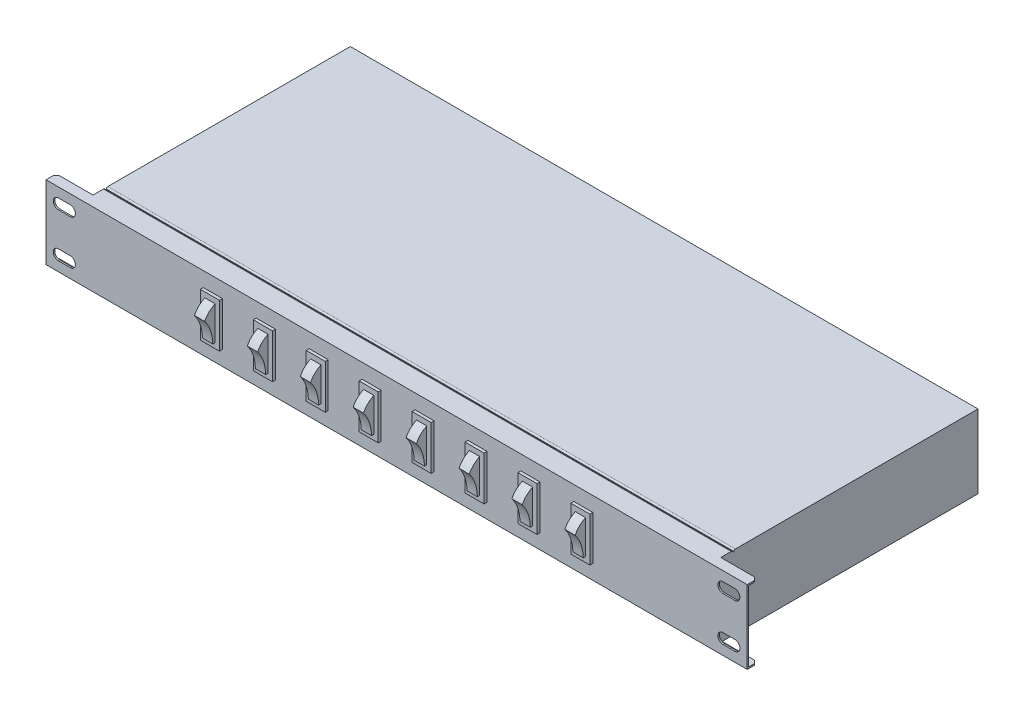
from build123d import *

# Parameters (mm, degrees)
SKETCH1_W           = 427
SKETCH1_H           = 182
BOSS_EXTRUDE1_DEPTH = 50
SKETCH2_W           = 25
SKETCH2_H           = 50
BOSS_EXTRUDE2_DEPTH = 1
SKETCH3_W           = 25
SKETCH3_H           = 1
BOSS_EXTRUDE3_DEPTH = 6
CHAMFER1_SIZE       = 2
SKETCH4_W           = 13
SKETCH4_H           = 30
BOSS_EXTRUDE4_DEPTH = 2
SKETCH5_W           = 7
SKETCH5_H           = 23
BOSS_EXTRUDE5_DEPTH = 7
CUT_EXTRUDE1_DEPTH  = 267
SKETCH7_W           = 427
SKETCH7_H           = 1
CUT_EXTRUDE2_DEPTH  = 1
SKETCH8_W           = 427
SKETCH8_H           = 1
CUT_EXTRUDE3_DEPTH  = 1
FILLET1_R           = 1
SKETCH9_W           = 29
SKETCH9_H           = 26
BOSS_EXTRUDE6_DEPTH = 4
SKETCH10_R          = 2.375
SKETCH10_W          = 1.5
SKETCH10_H          = 6.35
CUT_EXTRUDE4_DEPTH  = 15
CHAMFER2_SIZE       = 1
BOSS_EXTRUDE7_DEPTH = 3.5
BOSS_EXTRUDE8_DEPTH = 1.5
SKETCH13_W          = 24
SKETCH13_H          = 12
SKETCH13_W_2        = 16
SKETCH13_H_2        = 4
CUT_EXTRUDE5_DEPTH  = 15
SKETCH14_W          = 1.5
SKETCH14_H          = 3
BOSS_EXTRUDE9_DEPTH = 14
CHAMFER3_SIZE       = 0.75
SKETCH15_W          = 24
SKETCH15_H          = 8
SKETCH15_W_2        = 23
SKETCH15_H_2        = 7
CUT_EXTRUDE6_DEPTH  = 0.5


with BuildPart() as part:
    # Sketch1 → Boss-Extrude1 (new body)
    with BuildSketch(Plane(origin=(0, 0, 0), x_dir=(1, 0, 0), z_dir=(0, 1, 0))):
        with Locations((213.5, 91)):
            Rectangle(SKETCH1_W, SKETCH1_H)
    extrude(amount=BOSS_EXTRUDE1_DEPTH)

    # Sketch2 → Boss-Extrude2 (add)
    # profile 1 of 2: a face of its own
    with BuildSketch(Plane.XY):
        with Locations((-12.5, 25)):
            Rectangle(SKETCH2_W, SKETCH2_H)
        with BuildLine():
            ThreePointArc((-16.538466331, 6.5), (-20.038466331, 10), (-16.538466331, 13.5))
            Line((-16.538466331, 13.5), (-8.538466331, 13.5))
            ThreePointArc((-8.538466331, 13.5), (-6.063592596, 12.474873734), (-5.038466331, 10))
            ThreePointArc((-5.038466331, 10), (-6.063592596, 7.525126266), (-8.538466331, 6.5))
            Line((-8.538466331, 6.5), (-16.538466331, 6.5))
        make_face(mode=Mode.SUBTRACT)
        with BuildLine():
            ThreePointArc((-16.538466331, 36.5), (-20.038466331, 40), (-16.538466331, 43.5))
            Line((-16.538466331, 43.5), (-8.538466331, 43.5))
            ThreePointArc((-8.538466331, 43.5), (-6.063592596, 42.474873734), (-5.038466331, 40))
            ThreePointArc((-5.038466331, 40), (-6.063592596, 37.525126266), (-8.538466331, 36.5))
            Line((-8.538466331, 36.5), (-16.538466331, 36.5))
        make_face(mode=Mode.SUBTRACT)
    # profile 2 of 2: a face of its own
    with BuildSketch(Plane.XY):
        with Locations((439.5, 25)):
            Rectangle(SKETCH2_W, SKETCH2_H)
        with BuildLine():
            ThreePointArc((447.038466331, 10), (446.013340065, 7.525126266), (443.538466331, 6.5))
            Line((443.538466331, 6.5), (435.538466331, 6.5))
            ThreePointArc((435.538466331, 6.5), (432.038466331, 10), (435.538466331, 13.5))
            Line((435.538466331, 13.5), (443.538466331, 13.5))
            ThreePointArc((443.538466331, 13.5), (446.013340065, 12.474873734), (447.038466331, 10))
        make_face(mode=Mode.SUBTRACT)
        with BuildLine():
            ThreePointArc((447.038466331, 40), (446.013340065, 37.525126266), (443.538466331, 36.5))
            Line((443.538466331, 36.5), (435.538466331, 36.5))
            ThreePointArc((435.538466331, 36.5), (432.038466331, 40), (435.538466331, 43.5))
            Line((435.538466331, 43.5), (443.538466331, 43.5))
            ThreePointArc((443.538466331, 43.5), (446.013340065, 42.474873734), (447.038466331, 40))
        make_face(mode=Mode.SUBTRACT)
    extrude(amount=-BOSS_EXTRUDE2_DEPTH)

    # Sketch3 → Boss-Extrude3 (add)
    with BuildSketch(Plane(origin=(0, 0, -1), x_dir=(-1, 0, 0), z_dir=(0, 0, -1))):
        with Locations((12.5, 0.5)):
            Rectangle(SKETCH3_W, SKETCH3_H)
        with Locations((12.5, 49.5)):
            Rectangle(SKETCH3_W, SKETCH3_H)
        with Locations((-439.5, 49.5)):
            Rectangle(SKETCH3_W, SKETCH3_H)
        with Locations((-439.5, 0.5)):
            Rectangle(SKETCH3_W, SKETCH3_H)
    extrude(amount=BOSS_EXTRUDE3_DEPTH)

    # Chamfer1
    chamfer1_edges = [part.edges().sort_by_distance(p)[0] for p in [
        (452, 49.5, -7),
        (452, 0.5, -7),
        (-25, 0.5, -7),
        (-25, 49.5, -7),
    ]]
    chamfer(chamfer1_edges, length=CHAMFER1_SIZE)

    # Sketch4 → Boss-Extrude4 (add)
    with BuildSketch(Plane.XY):
        with Locations((88.5, 25)):
            Rectangle(SKETCH4_W, SKETCH4_H)
        with Locations((124.5, 25)):
            Rectangle(SKETCH4_W, SKETCH4_H)
        with Locations((160.5, 25)):
            Rectangle(SKETCH4_W, SKETCH4_H)
        with Locations((196.5, 25)):
            Rectangle(SKETCH4_W, SKETCH4_H)
        with Locations((232.5, 25)):
            Rectangle(SKETCH4_W, SKETCH4_H)
        with Locations((268.5, 25)):
            Rectangle(SKETCH4_W, SKETCH4_H)
        with Locations((304.5, 25)):
            Rectangle(SKETCH4_W, SKETCH4_H)
        with Locations((340.5, 25)):
            Rectangle(SKETCH4_W, SKETCH4_H)
    extrude(amount=BOSS_EXTRUDE4_DEPTH)

    # Sketch5 → Boss-Extrude5 (add)
    with BuildSketch(Plane.XY.offset(2)):
        with Locations((88.5, 25)):
            Rectangle(SKETCH5_W, SKETCH5_H)
        with Locations((124.5, 25)):
            Rectangle(SKETCH5_W, SKETCH5_H)
        with Locations((160.5, 25)):
            Rectangle(SKETCH5_W, SKETCH5_H)
        with Locations((196.5, 25)):
            Rectangle(SKETCH5_W, SKETCH5_H)
        with Locations((232.5, 25)):
            Rectangle(SKETCH5_W, SKETCH5_H)
        with Locations((268.5, 25)):
            Rectangle(SKETCH5_W, SKETCH5_H)
        with Locations((304.5, 25)):
            Rectangle(SKETCH5_W, SKETCH5_H)
        with Locations((340.5, 25)):
            Rectangle(SKETCH5_W, SKETCH5_H)
    extrude(amount=BOSS_EXTRUDE5_DEPTH)

    # Sketch6 → Cut-Extrude1 (cut)
    with BuildSketch(Plane.ZY.offset(-85)):
        with BuildLine():
            add(Edge.make_bspline(
                [(3.5, 13.5), (3.899235476, 22.933492856), (9, 29.5)],
                knots=[0, 0, 0, 0.757593428, 0.757593428, 0.757593428], degree=2))
            Line((3.5, 13.5), (9, 13.5))
            Line((9, 13.5), (9, 29.5))
        make_face()
        with BuildLine():
            Line((9, 36.5), (2, 36.5))
            add(Edge.make_bspline(
                [(2, 36.5), (7.238831178, 33.720247457), (9, 29.5)],
                knots=[0, 0, 0, 0.496808908, 0.496808908, 0.496808908], degree=2))
            Line((9, 29.5), (9, 36.5))
        make_face()
    extrude(amount=-CUT_EXTRUDE1_DEPTH, mode=Mode.SUBTRACT)

    # Sketch7 → Cut-Extrude2 (cut)
    with BuildSketch(Plane(origin=(0, 50, 0), x_dir=(1, 0, 0), z_dir=(0, 1, 0))):
        with Locations((213.5, 15.5)):
            Rectangle(SKETCH7_W, SKETCH7_H)
    extrude(amount=-CUT_EXTRUDE2_DEPTH, mode=Mode.SUBTRACT)

    # Sketch8 → Cut-Extrude3 (cut)
    with BuildSketch(Plane.XZ):
        with Locations((213.5, -15.5)):
            Rectangle(SKETCH8_W, SKETCH8_H)
    extrude(amount=-CUT_EXTRUDE3_DEPTH, mode=Mode.SUBTRACT)

    # Fillet1
    fillet1_edges = [part.edges().sort_by_distance(p)[0] for p in [
        (213.5, 50, -15),
        (213.5, 50, -16),
        (213.5, 0, -15),
        (213.5, 0, -16),
    ]]
    fillet(fillet1_edges, radius=FILLET1_R - 0.0001)  # a hair under: the kernel refuses the full size

    # Sketch9 → Boss-Extrude6 (add)
    with BuildSketch(Plane(origin=(0, 0, -182), x_dir=(-1, 0, 0), z_dir=(0, 0, -1))):
        with Locations((-368.5, 25)):
            Rectangle(SKETCH9_W, SKETCH9_H)
        with Locations((-328.5, 25)):
            Rectangle(SKETCH9_W, SKETCH9_H)
        with Locations((-288.5, 25)):
            Rectangle(SKETCH9_W, SKETCH9_H)
        with Locations((-248.5, 25)):
            Rectangle(SKETCH9_W, SKETCH9_H)
        with Locations((-208.5, 25)):
            Rectangle(SKETCH9_W, SKETCH9_H)
        with Locations((-168.5, 25)):
            Rectangle(SKETCH9_W, SKETCH9_H)
        with Locations((-128.5, 25)):
            Rectangle(SKETCH9_W, SKETCH9_H)
        with Locations((-88.5, 25)):
            Rectangle(SKETCH9_W, SKETCH9_H)
    extrude(amount=BOSS_EXTRUDE6_DEPTH)

    # Sketch10 → Cut-Extrude4 (cut)
    with BuildSketch(Plane(origin=(0, 0, -186), x_dir=(-1, 0, 0), z_dir=(0, 0, -1))):
        with Locations((-368.5, 18)):
            Circle(SKETCH10_R)
        with Locations((-328.5, 18)):
            Circle(SKETCH10_R)
        with Locations((-288.5, 18)):
            Circle(SKETCH10_R)
        with Locations((-248.5, 18)):
            Circle(SKETCH10_R)
        with Locations((-208.5, 18)):
            Circle(SKETCH10_R)
        with Locations((-168.5, 18)):
            Circle(SKETCH10_R)
        with Locations((-128.5, 18)):
            Circle(SKETCH10_R)
        with Locations((-88.5, 18)):
            Circle(SKETCH10_R)
        with Locations((-374.85, 29.9)):
            Rectangle(SKETCH10_W, SKETCH10_H)
        with Locations((-362.15, 29.9)):
            Rectangle(SKETCH10_W, SKETCH10_H)
        with Locations((-322.15, 29.9)):
            Rectangle(SKETCH10_W, SKETCH10_H)
        with Locations((-334.85, 29.9)):
            Rectangle(SKETCH10_W, SKETCH10_H)
        with Locations((-282.15, 29.9)):
            Rectangle(SKETCH10_W, SKETCH10_H)
        with Locations((-294.85, 29.9)):
            Rectangle(SKETCH10_W, SKETCH10_H)
        with Locations((-242.15, 29.9)):
            Rectangle(SKETCH10_W, SKETCH10_H)
        with Locations((-254.85, 29.9)):
            Rectangle(SKETCH10_W, SKETCH10_H)
        with Locations((-202.15, 29.9)):
            Rectangle(SKETCH10_W, SKETCH10_H)
        with Locations((-214.85, 29.9)):
            Rectangle(SKETCH10_W, SKETCH10_H)
        with Locations((-162.15, 29.9)):
            Rectangle(SKETCH10_W, SKETCH10_H)
        with Locations((-174.85, 29.9)):
            Rectangle(SKETCH10_W, SKETCH10_H)
        with Locations((-122.15, 29.9)):
            Rectangle(SKETCH10_W, SKETCH10_H)
        with Locations((-134.85, 29.9)):
            Rectangle(SKETCH10_W, SKETCH10_H)
        with Locations((-82.15, 29.9)):
            Rectangle(SKETCH10_W, SKETCH10_H)
        with Locations((-94.85, 29.9)):
            Rectangle(SKETCH10_W, SKETCH10_H)
    extrude(amount=-CUT_EXTRUDE4_DEPTH, mode=Mode.SUBTRACT)

    # Chamfer2
    chamfer2_edges = [part.edges().sort_by_distance(p)[0] for p in [
        (370.875, 18, -186),
        (375.6, 29.9, -186),
        (374.85, 26.725, -186),
        (374.1, 29.9, -186),
        (374.85, 33.075, -186),
        (362.9, 29.9, -186),
        (362.15, 26.725, -186),
        (361.4, 29.9, -186),
        (362.15, 33.075, -186),
        (330.875, 18, -186),
        (334.85, 33.075, -186),
        (335.6, 29.9, -186),
        (334.85, 26.725, -186),
        (334.1, 29.9, -186),
        (322.15, 33.075, -186),
        (322.9, 29.9, -186),
        (322.15, 26.725, -186),
        (321.4, 29.9, -186),
        (290.875, 18, -186),
        (294.85, 33.075, -186),
        (295.6, 29.9, -186),
        (294.85, 26.725, -186),
        (294.1, 29.9, -186),
        (282.15, 33.075, -186),
        (282.9, 29.9, -186),
        (282.15, 26.725, -186),
        (281.4, 29.9, -186),
        (250.875, 18, -186),
        (254.85, 33.075, -186),
        (255.6, 29.9, -186),
        (254.85, 26.725, -186),
        (254.1, 29.9, -186),
        (242.15, 33.075, -186),
        (242.9, 29.9, -186),
        (242.15, 26.725, -186),
        (241.4, 29.9, -186),
        (210.875, 18, -186),
        (214.85, 33.075, -186),
        (215.6, 29.9, -186),
        (214.85, 26.725, -186),
        (214.1, 29.9, -186),
        (202.15, 33.075, -186),
        (202.9, 29.9, -186),
        (202.15, 26.725, -186),
        (201.4, 29.9, -186),
        (170.875, 18, -186),
        (174.85, 33.075, -186),
        (175.6, 29.9, -186),
        (174.85, 26.725, -186),
        (174.1, 29.9, -186),
        (162.15, 33.075, -186),
        (162.9, 29.9, -186),
        (162.15, 26.725, -186),
        (161.4, 29.9, -186),
        (130.875, 18, -186),
        (134.85, 33.075, -186),
        (135.6, 29.9, -186),
        (134.85, 26.725, -186),
        (134.1, 29.9, -186),
        (122.15, 33.075, -186),
        (122.9, 29.9, -186),
        (122.15, 26.725, -186),
        (121.4, 29.9, -186),
        (90.875, 18, -186),
        (94.85, 33.075, -186),
        (95.6, 29.9, -186),
        (94.85, 26.725, -186),
        (94.1, 29.9, -186),
        (82.15, 33.075, -186),
        (82.9, 29.9, -186),
        (82.15, 26.725, -186),
        (81.4, 29.9, -186),
    ]]
    chamfer(chamfer2_edges, length=CHAMFER2_SIZE)

    # Sketch11 → Boss-Extrude7 (add)
    with BuildSketch(Plane(origin=(0, 0, -182), x_dir=(-1, 0, 0), z_dir=(0, 0, -1))):
        with BuildLine():
            Line((-17.536290504, 40.5), (-42.536290504, 40.5))
            ThreePointArc((-42.536290504, 40.5), (-43.950504066, 39.914213562), (-44.536290504, 38.5))
            Line((-44.536290504, 38.5), (-44.536290504, 11.5))
            ThreePointArc((-44.536290504, 11.5), (-43.950504066, 10.085786438), (-42.536290504, 9.5))
            Line((-42.536290504, 9.5), (-17.536290504, 9.5))
            ThreePointArc((-17.536290504, 9.5), (-16.122076942, 10.085786438), (-15.536290504, 11.5))
            Line((-15.536290504, 11.5), (-15.536290504, 38.5))
            ThreePointArc((-15.536290504, 38.5), (-16.122076942, 39.914213562), (-17.536290504, 40.5))
        make_face()
    extrude(amount=BOSS_EXTRUDE7_DEPTH)

    # Sketch12 → Boss-Extrude8 (add)
    with BuildSketch(Plane(origin=(0, 0, -185.5), x_dir=(-1, 0, 0), z_dir=(0, 0, -1))):
        with BuildLine():
            Line((-17.536290504, 39.5), (-42.536290504, 39.5))
            ThreePointArc((-42.536290504, 39.5), (-43.243397285, 39.207106781), (-43.536290504, 38.5))
            Line((-43.536290504, 38.5), (-43.536290504, 11.5))
            ThreePointArc((-43.536290504, 11.5), (-43.243397285, 10.792893219), (-42.536290504, 10.5))
            Line((-42.536290504, 10.5), (-17.536290504, 10.5))
            ThreePointArc((-17.536290504, 10.5), (-16.829183723, 10.792893219), (-16.536290504, 11.5))
            Line((-16.536290504, 11.5), (-16.536290504, 38.5))
            ThreePointArc((-16.536290504, 38.5), (-16.829183723, 39.207106781), (-17.536290504, 39.5))
        make_face()
    extrude(amount=BOSS_EXTRUDE8_DEPTH)

    # Sketch13 → Cut-Extrude5 (cut)
    with BuildSketch(Plane(origin=(0, 0, -187), x_dir=(-1, 0, 0), z_dir=(0, 0, -1))):
        with Locations((-30.036290504, 27.5)):
            Rectangle(SKETCH13_W, SKETCH13_H)
        Polygon((-38.036290504, 37.5), (-42.036290504, 33.5), (-38.036290504, 33.5), align=None)
        with Locations((-30.036290504, 35.5)):
            Rectangle(SKETCH13_W_2, SKETCH13_H_2)
        Polygon((-22.036290504, 33.5), (-18.036290504, 33.5), (-22.036290504, 37.5), align=None)
    extrude(amount=-CUT_EXTRUDE5_DEPTH, mode=Mode.SUBTRACT)

    # Sketch14 → Boss-Extrude9 (add)
    with BuildSketch(Plane(origin=(0, 0, -172), x_dir=(-1, 0, 0), z_dir=(0, 0, -1))):
        with Locations((-37.286290504, 27.690006757)):
            Rectangle(SKETCH14_W, SKETCH14_H)
        with Locations((-22.286290504, 27.690006757)):
            Rectangle(SKETCH14_W, SKETCH14_H)
        with Locations((-30.036290504, 32.690006757)):
            Rectangle(SKETCH14_W, SKETCH14_H)
    extrude(amount=BOSS_EXTRUDE9_DEPTH)

    # Chamfer3
    chamfer3_edges = [part.edges().sort_by_distance(p)[0] for p in [
        (37.286290504, 26.190006757, -186),
        (37.286290504, 29.190006757, -186),
        (22.286290504, 26.190006757, -186),
        (22.286290504, 29.190006757, -186),
        (30.036290504, 31.190006757, -186),
        (30.036290504, 34.190006757, -186),
    ]]
    chamfer(chamfer3_edges, length=CHAMFER3_SIZE)

    # Sketch15 → Cut-Extrude6 (cut)
    with BuildSketch(Plane(origin=(0, 0, -187), x_dir=(-1, 0, 0), z_dir=(0, 0, -1))):
        with Locations((-30.036290504, 16)):
            Rectangle(SKETCH15_W, SKETCH15_H)
        with Locations((-30.036290504, 16)):
            Rectangle(SKETCH15_W_2, SKETCH15_H_2, mode=Mode.SUBTRACT)
    extrude(amount=-CUT_EXTRUDE6_DEPTH, mode=Mode.SUBTRACT)


solid = part.part
